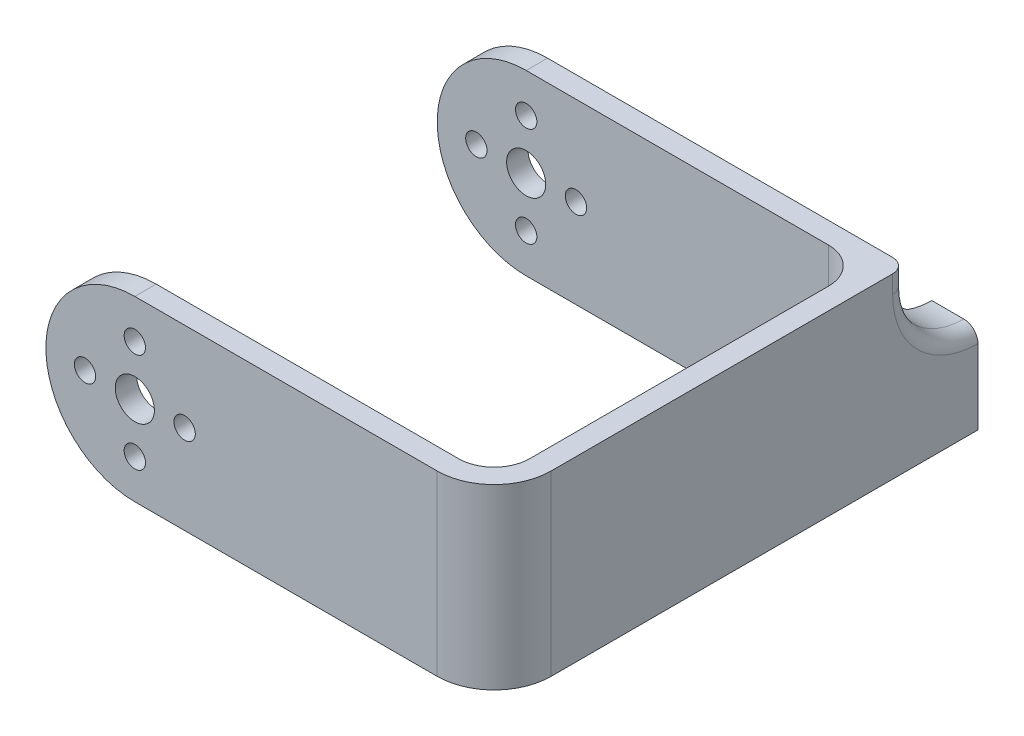
from build123d import *

# Parameters (mm, degrees)
BOSS_EXTRU_1_DEPTH      = 12.5
BOSS_EXTRU_1_DEPTH_BACK = 12.5
ESQUISSE2_R             = 2.75
ESQUISSE2_R_2           = 1.5
ENL_V_MAT_EXTRU_2_DEPTH = 87.540452969
ESQUISSE3_W             = 25
ESQUISSE3_H             = 10
BOSS_EXTRU_2_DEPTH      = 12.5
ENL_V_MAT_EXTRU_3_DEPTH = 7.5
CONG_1_R                = 8
ESQUISSE5_R             = 5
ENL_V_MAT_EXTRU_4_DEPTH = 77.746335417
ENL_V_MAT_EXTRU_5_DEPTH = 4
CONG_2_R                = 10
CONG_3_R                = 2


with BuildPart() as part:
    # Esquisse1 → Boss.-Extru.1 (new, two sides: drawn at the far end of the back side and taken through both)
    with BuildSketch(Plane(origin=(0, 0, 0), x_dir=(1, 0, 0), z_dir=(0, 1, 0)).offset(-BOSS_EXTRU_1_DEPTH_BACK)):
        with BuildLine():
            Line((-3, 21), (-3, -21))
            ThreePointArc((-3, -21), (-4.464466094, -24.535533906), (-8, -26))
            Line((-8, -26), (-63, -26))
            Line((-63, -26), (-63, -29))
            Line((-63, -29), (-3, -29))
            Line((-3, -29), (0, -29))
            Line((0, -29), (0, 29))
            Line((0, 29), (-3, 29))
            Line((-3, 29), (-63, 29))
            Line((-63, 29), (-63, 26))
            Line((-63, 26), (-8, 26))
            ThreePointArc((-8, 26), (-4.464466094, 24.535533906), (-3, 21))
        make_face()
    extrude(amount=BOSS_EXTRU_1_DEPTH + BOSS_EXTRU_1_DEPTH_BACK)

    # Esquisse2 → Enlèv. mat.-Extru.2 (cut, through all)
    with BuildSketch(Plane.XY.offset(29)):
        with Locations((-50.5, 0)):
            Circle(ESQUISSE2_R)
        with Locations((-57.5, 0)):
            Circle(ESQUISSE2_R_2)
        with Locations((-50.5, 7)):
            Circle(ESQUISSE2_R_2)
        with Locations((-43.5, 0)):
            Circle(ESQUISSE2_R_2)
        with Locations((-50.5, -7)):
            Circle(ESQUISSE2_R_2)
        with BuildLine():
            Line((-50.5, 12.5), (-68.703776387, 33.647767052))
            Line((-68.703776387, 33.647767052), (-74.904354154, -25.066543002))
            Line((-74.904354154, -25.066543002), (-54.406878728, -18.845916132))
            Line((-54.406878728, -18.845916132), (-50.5, -12.5))
            ThreePointArc((-50.5, -12.5), (-63, 0), (-50.5, 12.5))
        make_face()
    extrude(amount=-ENL_V_MAT_EXTRU_2_DEPTH, mode=Mode.SUBTRACT)

    # Esquisse3 → Boss.-Extru.2 (add)
    with BuildSketch(Plane(origin=(0, 0, 0), x_dir=(1, 0, 0), z_dir=(0, 1, 0))):
        with Locations((-12.5, 34)):
            Rectangle(ESQUISSE3_W, ESQUISSE3_H)
    extrude(amount=-BOSS_EXTRU_2_DEPTH)

    # Esquisse4 → Enlèv. mat.-Extru.3 (cut)
    with BuildSketch(Plane(origin=(0, 0, 0), x_dir=(1, 0, 0), z_dir=(0, 1, 0))):
        Polygon((-18.5, 39), (-6.5, 44), (-6.5, 35.535898385), (-12.5, 32.07179677), (-18.5, 35.535898385), align=None)
    extrude(amount=-ENL_V_MAT_EXTRU_3_DEPTH, mode=Mode.SUBTRACT)

    # Congé1
    cong_1_edges = [part.edges().sort_by_distance(p)[0] for p in [
        (0, 0, 29),
    ]]
    fillet(cong_1_edges, radius=CONG_1_R)

    # Esquisse5 → Enlèv. mat.-Extru.4 (cut, through all)
    with BuildSketch(Plane(origin=(0, -7.5, 0), x_dir=(1, 0, 0), z_dir=(0, 1, 0))):
        with Locations((-12.5, 39)):
            Circle(ESQUISSE5_R)
    extrude(amount=-ENL_V_MAT_EXTRU_4_DEPTH, mode=Mode.SUBTRACT)

    # Esquisse6 → Enlèv. mat.-Extru.5 (cut)
    with BuildSketch(Plane(origin=(0, 0, -39), x_dir=(-1, 0, 0), z_dir=(0, 0, -1))):
        with BuildLine():
            Line((4.85, -3.2), (4.85, -9.3))
            ThreePointArc((4.85, -9.3), (3.25, -10.9), (1.65, -9.3))
            Line((1.65, -9.3), (1.65, -3.2))
            ThreePointArc((1.65, -3.2), (3.25, -1.6), (4.85, -3.2))
        make_face()
        with BuildLine():
            Line((20.15, -3.2), (20.15, -9.3))
            ThreePointArc((20.15, -9.3), (21.75, -10.9), (23.35, -9.3))
            Line((23.35, -9.3), (23.35, -3.2))
            ThreePointArc((23.35, -3.2), (21.75, -1.6), (20.15, -3.2))
        make_face()
    extrude(amount=-ENL_V_MAT_EXTRU_5_DEPTH, mode=Mode.SUBTRACT)

    # Congé2
    # the kernel refuses this fillet: 10 mm, written as the material it adds along each edge
    with BuildSketch(Plane(origin=(0, 0, -29), x_dir=(0, 1, 0), z_dir=(-1, 0, 0))) as cong_2_piece_1_section:
        with BuildLine():
            CenterArc((CONG_2_R, CONG_2_R), CONG_2_R, 180, 90)
            Line((0, CONG_2_R), (0, 0))
            Line((0, 0), (CONG_2_R, 0))
        make_face()
    cong_2_piece_1 = extrude(amount=50, mode=Mode.PRIVATE)
    cong_2_piece_1 = split(cong_2_piece_1, bisect_by=Plane(origin=(-5.932407877, 2.249723915, -35.86359785), z_dir=(0.5000000000000038, 0, 0.8660254037844365)), keep=Keep.TOP, mode=Mode.PRIVATE)
    add(cong_2_piece_1)
    with BuildSketch(Plane(origin=(25, 0, -29), x_dir=(0, 1, 0), z_dir=(-1, 0, 0))) as cong_2_piece_2_section:
        with BuildLine():
            CenterArc((CONG_2_R, CONG_2_R), CONG_2_R, 180, 90)
            Line((0, CONG_2_R), (0, 0))
            Line((0, 0), (CONG_2_R, 0))
        make_face()
    cong_2_piece_2 = extrude(amount=75, mode=Mode.PRIVATE)
    cong_2_piece_2 = split(cong_2_piece_2, bisect_by=Plane(origin=(-6.5, 0.122528236, -36.916597474), z_dir=(1, 0, 0)), keep=Keep.TOP, mode=Mode.PRIVATE)
    cong_2_piece_2 = split(cong_2_piece_2, bisect_by=Plane(origin=(-5.005349392, 0.122528236, -36.398835316), z_dir=(-0.5000000000000038, 0, -0.8660254037844365)), keep=Keep.TOP, mode=Mode.PRIVATE)
    add(cong_2_piece_2)
    with BuildSketch(Plane(origin=(25, 0, -29), x_dir=(0, 1, 0), z_dir=(-1, 0, 0))) as cong_2_piece_3_section:
        with BuildLine():
            CenterArc((CONG_2_R, CONG_2_R), CONG_2_R, 180, 90)
            Line((0, CONG_2_R), (0, 0))
            Line((0, 0), (CONG_2_R, 0))
        make_face()
    cong_2_piece_3 = extrude(amount=50, mode=Mode.PRIVATE)
    cong_2_piece_3 = split(cong_2_piece_3, bisect_by=Plane(origin=(-18.5, 0.122528236, -36.916597474), z_dir=(-1, 0, 0)), keep=Keep.TOP, mode=Mode.PRIVATE)
    add(cong_2_piece_3)
    with BuildSketch(Plane(origin=(25, 0, -29), x_dir=(0, 1, 0), z_dir=(-1, 0, 0))) as cong_2_piece_4_section:
        with BuildLine():
            CenterArc((CONG_2_R, CONG_2_R), CONG_2_R, 180, 90)
            Line((0, CONG_2_R), (0, 0))
            Line((0, 0), (CONG_2_R, 0))
        make_face()
    cong_2_piece_4 = extrude(amount=75, mode=Mode.PRIVATE)
    cong_2_piece_4 = split(cong_2_piece_4, bisect_by=Plane(origin=(-15.261211998, 1.931548804, -33.66598326), z_dir=(-0.4999999999999996, 0, 0.8660254037844389)), keep=Keep.TOP, mode=Mode.PRIVATE)
    cong_2_piece_4 = split(cong_2_piece_4, bisect_by=Plane(origin=(-18.5, 1.931548804, -31.415325701), z_dir=(1, 0, 0)), keep=Keep.TOP, mode=Mode.PRIVATE)
    add(cong_2_piece_4)

    # Congé3
    cong_3_edges = [part.edges().sort_by_distance(p)[0] for p in [
        (-25, 2.928932188, -31.928932188),
        (0, 2.928932188, -31.928932188),
        (0, 11.25, -29),
    ]]
    fillet(cong_3_edges, radius=CONG_3_R)


solid = part.part
